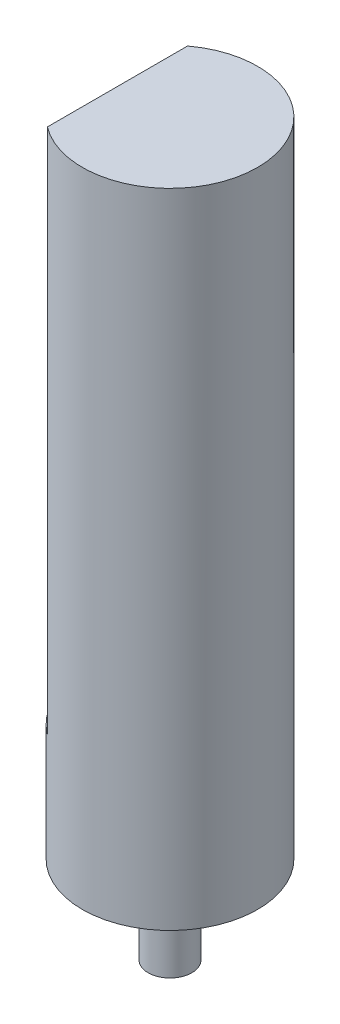
from build123d import *

# Parameters (mm, degrees)
SKETCH_1_R          = 1.5
EXTRUDE_1_DEPTH     = 11
CUT_EXTRUDE_START   = -9
CUT_EXTRUDE_1_DEPTH = 9
SKETCH_3_R          = 0.375
EXTRUDE_2_DEPTH     = 1.5


with BuildPart() as part:
    # Эскиз1 → Бобышка-Вытянуть1 (new body)
    with BuildSketch(Plane(origin=(0, 0, 0), x_dir=(1, 0, 0), z_dir=(0, 1, 0))):
        Circle(SKETCH_1_R)
    extrude(amount=EXTRUDE_1_DEPTH)

    # Эскиз2 → Вырез-Вытянуть1 (cut)
    with BuildSketch(Plane(origin=(0, 11, 0), x_dir=(1, 0, 0), z_dir=(0, 1, 0)).offset(CUT_EXTRUDE_START)):
        with BuildLine():
            Line((-0.9, -1.2), (-0.9, 1.2))
            ThreePointArc((-0.9, 1.2), (-1.5, 0), (-0.9, -1.2))
        make_face()
    extrude(amount=CUT_EXTRUDE_1_DEPTH, mode=Mode.SUBTRACT)

    # Эскиз3 → Бобышка-Вытянуть2 (add)
    with BuildSketch(Plane.XZ):
        Circle(SKETCH_3_R)
    extrude(amount=EXTRUDE_2_DEPTH)


solid = part.part
